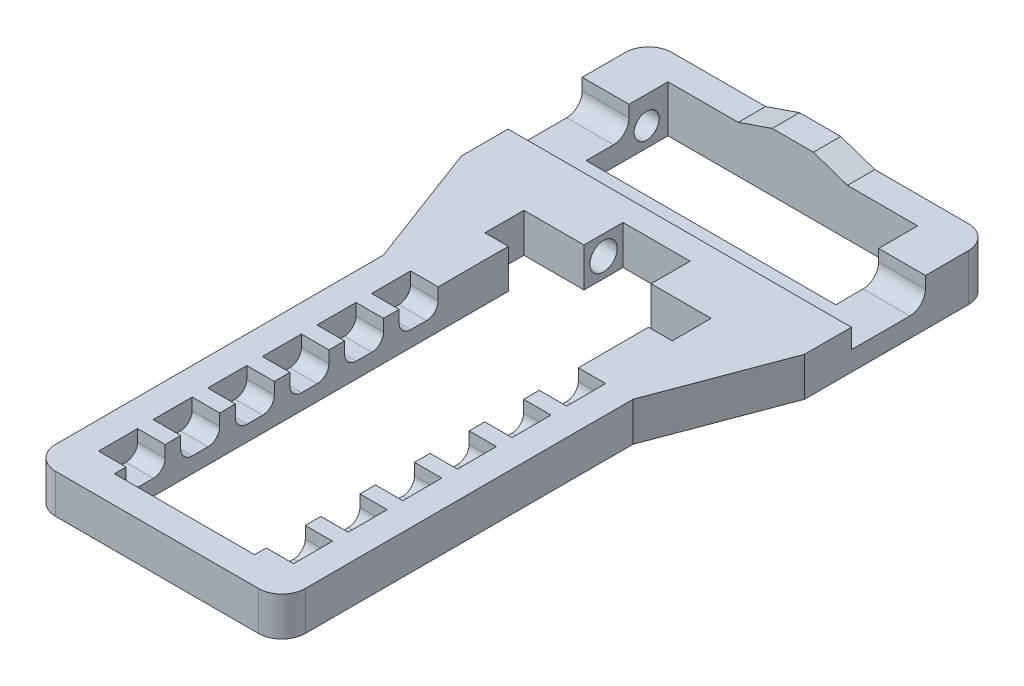
from build123d import *
from OCP.BRepFilletAPI import BRepFilletAPI_MakeChamfer

# Parameters (mm, degrees)
SKETCH1_W                = 44
SKETCH1_H                = 22
BOSS_EXTRUDE1_DEPTH      = 5
SKETCH2_W                = 3.531949687
SKETCH2_H                = 41.5
SKETCH2_W_2              = 3.5
BOSS_EXTRUDE2_DEPTH      = 2
SKETCH3_W                = 44
SKETCH3_H                = 9.5
CUT_EXTRUDE1_DEPTH       = 2.5
SKETCH4_W                = 17.968050313
SKETCH4_H                = 14
CUT_EXTRUDE2_DEPTH       = 5
SKETCH5_W                = 24
SKETCH5_H                = 5
CUT_EXTRUDE3_DEPTH       = 5
SKETCH6_W                = 8.6
SKETCH6_H                = 5
CUT_EXTRUDE4_DEPTH       = 5
SKETCH7_W                = 14
SKETCH7_H                = 2
BOSS_EXTRUDE3_DEPTH      = 1.5
CHAMFER1_SIZE            = 1.5
CHAMFER1_SIZE_2          = 4.356316317
SKETCH8_W                = 32
SKETCH8_H                = 10
CUT_EXTRUDE5_DEPTH       = 5
FILLET3_R                = 3
SKETCH9_R                = 1.75
CUT_EXTRUDE6_DEPTH       = 3
CUT_EXTRUDE7_START       = -3
SKETCH10_R               = 1.75
CUT_EXTRUDE7_DEPTH       = 3
SKETCH11_R               = 1.6
CUT_EXTRUDE8_DEPTH       = 3
CUT_EXTRUDE9_START       = -3
SKETCH12_R               = 1.6
CUT_EXTRUDE9_DEPTH       = 3
SKETCH13_W               = 3.531949687
SKETCH13_H               = 2
BOSS_EXTRUDE5_DEPTH      = 3
FILLET4_R                = 1.5
BOSS_EXTRUDE6_DEPTH      = 2
BOSS_EXTRUDE6_DEPTH_BACK = 2
SKETCH15_W               = 6
SKETCH15_H               = 1
BOSS_EXTRUDE7_DEPTH      = 4.5
FILLET5_R                = 2
FILLET6_R                = 3
CUT_EXTRUDE10_DEPTH      = 14.5
CUT_EXTRUDE10_DEPTH_BACK = 14.5
SKETCH16_W               = 32
SKETCH16_H               = 0.5


with BuildPart() as part:
    # Sketch1 → Boss-Extrude1 (new body)
    with BuildSketch(Plane(origin=(0, 0, 0), x_dir=(1, 0, 0), z_dir=(0, 1, 0))):
        with Locations((0, 9)):
            Rectangle(SKETCH1_W, SKETCH1_H)
        Polygon((-16, -18), (16, -18), (22, -2), (-22, -2), align=None)
        Polygon((-12.5, -18), (-16, -18), (-16, -63), (16, -63), (16, -18), (12.5, -18), (12.5, -59.5), (-12.5, -59.5), align=None)
    extrude(amount=BOSS_EXTRUDE1_DEPTH)

    # Sketch2 → Boss-Extrude2 (add)
    with BuildSketch(Plane.XZ):
        with Locations((-10.734025156, 38.75)):
            Rectangle(SKETCH2_W, SKETCH2_H)
        with Locations((10.75, 38.75)):
            Rectangle(SKETCH2_W_2, SKETCH2_H)
    extrude(amount=-BOSS_EXTRUDE2_DEPTH)

    # Sketch3 → Cut-Extrude1 (cut)
    with BuildSketch(Plane(origin=(0, 5, 0), x_dir=(1, 0, 0), z_dir=(0, 1, 0))):
        with Locations((0, 8.75)):
            Rectangle(SKETCH3_W, SKETCH3_H)
    extrude(amount=-CUT_EXTRUDE1_DEPTH, mode=Mode.SUBTRACT)

    # Sketch4 → Cut-Extrude2 (cut)
    with BuildSketch(Plane(origin=(0, 5, 0), x_dir=(1, 0, 0), z_dir=(0, 1, 0))):
        with Locations((0.015974843, -11)):
            Rectangle(SKETCH4_W, SKETCH4_H)
    extrude(amount=-CUT_EXTRUDE2_DEPTH, mode=Mode.SUBTRACT)

    # Sketch5 → Cut-Extrude3 (cut)
    with BuildSketch(Plane(origin=(0, 5, 0), x_dir=(1, 0, 0), z_dir=(0, 1, 0))):
        with Locations((0.031949687, -6.5)):
            Rectangle(SKETCH5_W, SKETCH5_H)
    extrude(amount=-CUT_EXTRUDE3_DEPTH, mode=Mode.SUBTRACT)

    # Sketch6 → Cut-Extrude4 (cut)
    with BuildSketch(Plane(origin=(0, 5, 0), x_dir=(1, 0, 0), z_dir=(0, 1, 0))):
        with Locations((0.031949687, -1.5)):
            Rectangle(SKETCH6_W, SKETCH6_H)
    extrude(amount=-CUT_EXTRUDE4_DEPTH, mode=Mode.SUBTRACT)

    # Sketch7 → Boss-Extrude3 (add)
    with BuildSketch(Plane(origin=(0, 5, 0), x_dir=(1, 0, 0), z_dir=(0, 1, 0))):
        with Locations((0, 19)):
            Rectangle(SKETCH7_W, SKETCH7_H)
    extrude(amount=BOSS_EXTRUDE3_DEPTH)

    # Chamfer1
    chamfer1_edges_1 = [part.edges().sort_by_distance(p)[0] for p in [
        (7, 6.5, -19),
    ]]
    chamfer1_side_1 = [part.faces().sort_by_distance(p)[0] for p in [
        (7, 6.47, -19),
    ]]
    chamfer1_edges_2 = [part.edges().sort_by_distance(p)[0] for p in [
        (-7, 6.5, -19),
    ]]
    chamfer1_side_2 = [part.faces().sort_by_distance(p)[0] for p in [
        (-7, 6.47, -19),
    ]]
    chamfer1 = BRepFilletAPI_MakeChamfer(part.part.solid().wrapped)
    for e in chamfer1_edges_1:
        chamfer1.Add(CHAMFER1_SIZE - 0.0001, CHAMFER1_SIZE_2 - 0.0001, e.wrapped, chamfer1_side_1[0].wrapped)
    for e in chamfer1_edges_2:
        chamfer1.Add(CHAMFER1_SIZE - 0.0001, CHAMFER1_SIZE_2 - 0.0001, e.wrapped, chamfer1_side_2[0].wrapped)
    add(Compound.cast(chamfer1.Shape()), mode=Mode.REPLACE)  # a hair under: the kernel refuses the full size

    # Sketch8 → Cut-Extrude5 (cut)
    with BuildSketch(Plane(origin=(0, 5, 0), x_dir=(1, 0, 0), z_dir=(0, 1, 0))):
        with Locations((0, 13)):
            Rectangle(SKETCH8_W, SKETCH8_H)
    extrude(amount=-CUT_EXTRUDE5_DEPTH, mode=Mode.SUBTRACT)

    # Fillet3
    fillet3_edges = [part.edges().sort_by_distance(p)[0] for p in [
        (16, 2.5, 63),
        (-16, 2.5, 63),
    ]]
    fillet(fillet3_edges, radius=FILLET3_R)

    # Sketch9 → Cut-Extrude6 (cut)
    with BuildSketch(Plane(origin=(-4.268050313, 0, 0), x_dir=(0, 0, -1), z_dir=(1, 0, 0))):
        with Locations((-1.5, 2.5)):
            Circle(SKETCH9_R)
    extrude(amount=-CUT_EXTRUDE6_DEPTH, mode=Mode.SUBTRACT)

    # Sketch10 → Cut-Extrude7 (cut)
    with BuildSketch(Plane.ZY.offset(-4.331949687).offset(CUT_EXTRUDE7_START)):
        with Locations(Location((1.5, 2.5, 0), (0, 0, 180))):
            Circle(SKETCH10_R)
    extrude(amount=CUT_EXTRUDE7_DEPTH, mode=Mode.SUBTRACT)

    # Sketch11 → Cut-Extrude8 (cut)
    with BuildSketch(Plane.ZY.offset(-16)):
        with Locations((-15.75, 2.5)):
            Circle(SKETCH11_R)
    extrude(amount=-CUT_EXTRUDE8_DEPTH, mode=Mode.SUBTRACT)

    # Sketch12 → Cut-Extrude9 (cut)
    with BuildSketch(Plane(origin=(-16, 0, 0), x_dir=(0, 0, -1), z_dir=(1, 0, 0)).offset(CUT_EXTRUDE9_START)):
        with Locations(Location((15.75, 2.5, 0), (0, 0, 180))):
            Circle(SKETCH12_R)
    extrude(amount=CUT_EXTRUDE9_DEPTH, mode=Mode.SUBTRACT)

    # Sketch13 → Boss-Extrude5 (add)
    with BuildSketch(Plane(origin=(0, 2, 0), x_dir=(1, 0, 0), z_dir=(0, 1, 0))):
        with Locations((-10.734025156, -24)):
            Rectangle(SKETCH13_W, SKETCH13_H)
        with Locations((10.765974844, -24)):
            Rectangle(SKETCH13_W, SKETCH13_H)
        with Locations((10.765974844, -31)):
            Rectangle(SKETCH13_W, SKETCH13_H)
        with Locations((10.765974844, -38)):
            Rectangle(SKETCH13_W, SKETCH13_H)
        with Locations((10.765974844, -45)):
            Rectangle(SKETCH13_W, SKETCH13_H)
        with Locations((10.765974844, -52)):
            Rectangle(SKETCH13_W, SKETCH13_H)
        with Locations((10.765974844, -59)):
            Rectangle(SKETCH13_W, SKETCH13_H)
        with Locations((-10.734025156, -31)):
            Rectangle(SKETCH13_W, SKETCH13_H)
        with Locations((-10.734025156, -38)):
            Rectangle(SKETCH13_W, SKETCH13_H)
        with Locations((-10.734025156, -45)):
            Rectangle(SKETCH13_W, SKETCH13_H)
        with Locations((-10.734025156, -52)):
            Rectangle(SKETCH13_W, SKETCH13_H)
        with Locations((-10.734025156, -59)):
            Rectangle(SKETCH13_W, SKETCH13_H)
    extrude(amount=BOSS_EXTRUDE5_DEPTH)

    # Fillet4
    fillet4_edges = [part.edges().sort_by_distance(p)[0] for p in [
        (-10.734025157, 2, 23),
        (-10.734025157, 2, 25),
        (10.75, 2, 23),
        (10.75, 2, 25),
        (10.75, 2, 30),
        (10.75, 2, 32),
        (10.75, 2, 37),
        (10.75, 2, 39),
        (10.75, 2, 44),
        (10.75, 2, 46),
        (10.75, 2, 51),
        (10.75, 2, 53),
        (10.75, 2, 58),
        (-10.734025157, 2, 30),
        (-10.734025157, 2, 32),
        (-10.734025157, 2, 37),
        (-10.734025157, 2, 39),
        (-10.734025157, 2, 44),
        (-10.734025157, 2, 46),
        (-10.734025157, 2, 51),
        (-10.734025157, 2, 53),
        (-10.734025157, 2, 58),
        (-10.734025157, 2, 18),
        (10.75, 2, 18),
    ]]
    fillet(fillet4_edges, radius=FILLET4_R)

    # Sketch14 → Boss-Extrude6 (add, two sides: drawn at the far end of the back side and taken through both)
    with BuildSketch(Plane(origin=(0, 0, -20), x_dir=(-1, 0, 0), z_dir=(0, 0, -1)).offset(-BOSS_EXTRUDE6_DEPTH_BACK)):
        Polygon((-22, 6), (-22, 0), (22, 0), (22, 6), (7, 6), (2.643683683, 7.5), (-2.643683683, 7.5), (-7, 6), align=None)
    extrude(amount=BOSS_EXTRUDE6_DEPTH + BOSS_EXTRUDE6_DEPTH_BACK)

    # Sketch15 → Boss-Extrude7 (add)
    with BuildSketch(Plane.XY.offset(-18)):
        with Locations((19, 5.5)):
            Rectangle(SKETCH15_W, SKETCH15_H)
        with Locations((-19, 5.5)):
            Rectangle(SKETCH15_W, SKETCH15_H)
    extrude(amount=BOSS_EXTRUDE7_DEPTH)

    # Fillet5
    fillet5_edges = [part.edges().sort_by_distance(p)[0] for p in [
        (-19, 2.5, -13.5),
        (19, 2.5, -13.5),
    ]]
    fillet(fillet5_edges, radius=FILLET5_R)

    # Fillet6
    fillet6_edges = [part.edges().sort_by_distance(p)[0] for p in [
        (22, 3, -22),
        (-22, 3, -22),
    ]]
    fillet(fillet6_edges, radius=FILLET6_R)

    # Sketch16 → Cut-Extrude10 (cut, two sides: drawn at the far end of the back side and taken through both)
    with BuildSketch(Plane(origin=(0, 6, 0), x_dir=(1, 0, 0), z_dir=(0, 1, 0)).offset(-CUT_EXTRUDE10_DEPTH_BACK)):
        with Locations((0, 18.25)):
            Rectangle(SKETCH16_W, SKETCH16_H)
    extrude(amount=CUT_EXTRUDE10_DEPTH + CUT_EXTRUDE10_DEPTH_BACK, mode=Mode.SUBTRACT)


solid = part.part
